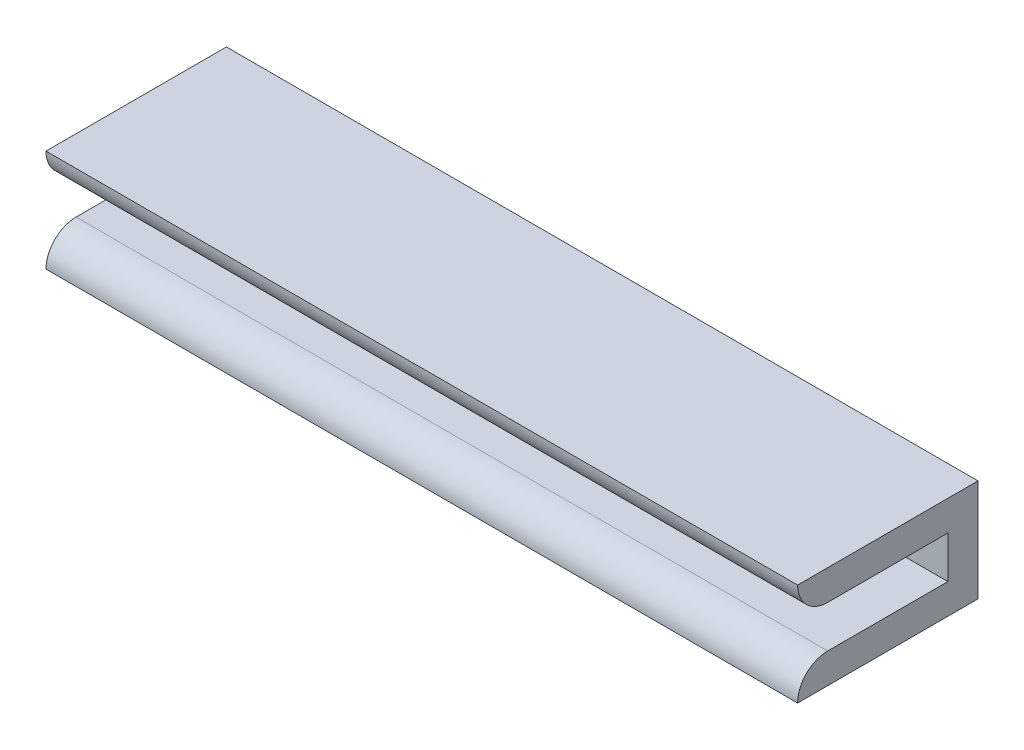
from build123d import *

# Parameters (mm, degrees)
SKETCH_1_W        = 50
SKETCH_1_H        = 2
EXTRUDE_1_DEPTH   = 10
EXTRUDE_1_2_DEPTH = 10
SKETCH_2_W        = 50
SKETCH_2_H        = 6.8
EXTRUDE_2_DEPTH   = 2
FILLET_1_R        = 2


with BuildPart() as part:
    # 草图1 → 凸台-拉伸1 (new body)
    with BuildSketch(Plane.XY):
        with Locations((25, 1)):
            Rectangle(SKETCH_1_W, SKETCH_1_H)
    extrude(amount=EXTRUDE_1_DEPTH)



with BuildPart() as body_2:
    # 草图1 → Extrude 1 2 (new body)
    with BuildSketch(Plane.XY):
        with Locations((25, -3.8)):
            Rectangle(SKETCH_1_W, SKETCH_1_H)
    extrude(amount=EXTRUDE_1_2_DEPTH)


with BuildPart() as part_1:
    add(part.part)

    add(body_2.part)  # 凸台-拉伸2 merges body 2
    # 草图2 → 凸台-拉伸2 (add)
    with BuildSketch(Plane(origin=(0, 0, 0), x_dir=(-1, 0, 0), z_dir=(0, 0, -1))):
        with Locations((-25, -1.4)):
            Rectangle(SKETCH_2_W, SKETCH_2_H)
    extrude(amount=EXTRUDE_2_DEPTH)

    # 圆角1
    fillet_1_edges = [part_1.edges().sort_by_distance(p)[0] for p in [
        (25, -2.8, 10),
        (25, 0, 10),
    ]]
    fillet(fillet_1_edges, radius=FILLET_1_R - 0.0001)  # a hair under: the kernel refuses the full size


solid = part_1.part
